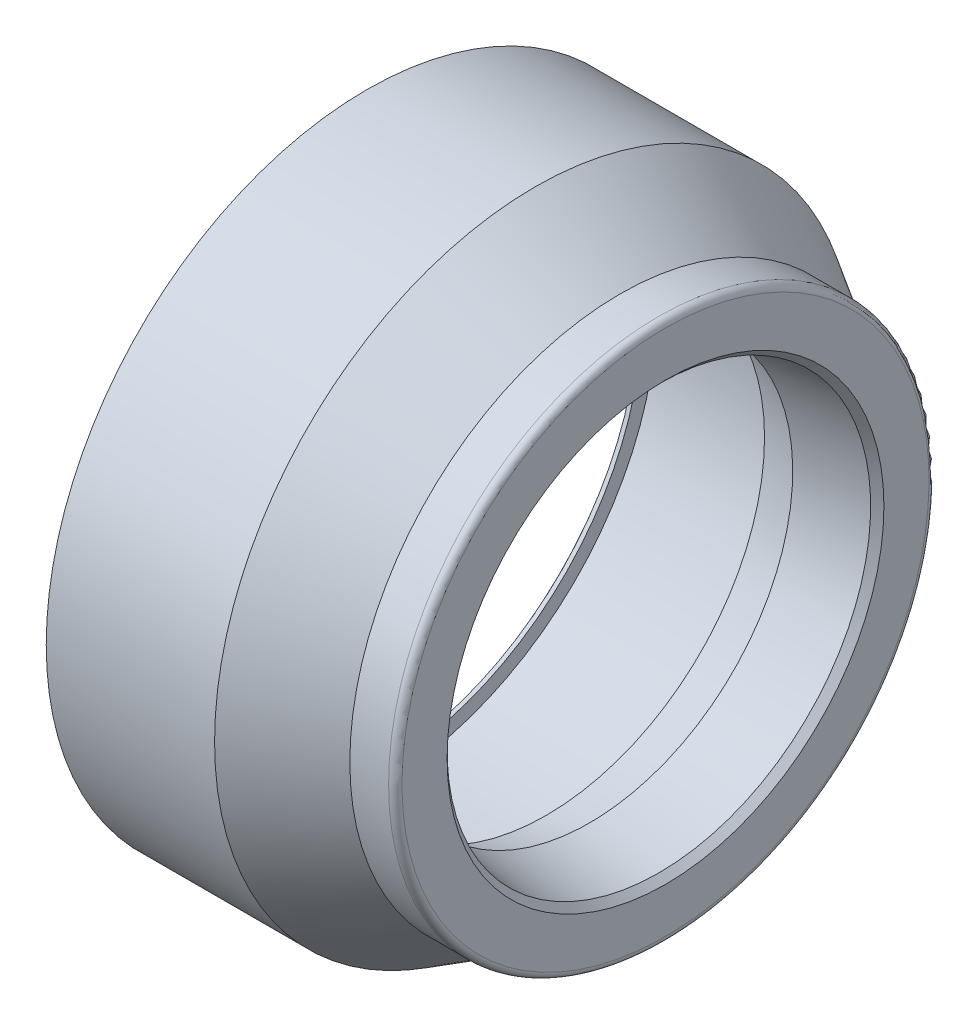
from build123d import *


with BuildPart() as part:
    # Sketch1 → Revolve1 (revolve)
    with BuildSketch(Plane.XY):
        with BuildLine():
            Line((0, 3.787125453), (-2.512581748, 1.274543705))
            Line((-2.512581748, 1.274543705), (-28.748040506, -1.99129637))
            Line((-28.748040506, -1.99129637), (-28.748040506, 1.274543705))
            Line((-28.748040506, 1.274543705), (-45.138961745, 3.724925992))
            Line((-45.138961745, 3.724925992), (-45.138961745, 23.778163338))
            ThreePointArc((-45.138961745, 23.778163338), (-45.88291052, 25.574214562), (-47.678961745, 26.318163338))
            Line((-47.678961745, 26.318163338), (-108.519758364, 26.318163338))
            Line((-108.519758364, 26.318163338), (-108.519758364, 20.827727871))
            Line((-108.519758364, 20.827727871), (-110.128287674, 20.827727871))
            Line((-110.128287674, 20.827727871), (-110.636200274, 24.90793993))
            Line((-110.636200274, 24.90793993), (-113.124151967, 25.000794493))
            Line((-113.124151967, 25.000794493), (-113.124151967, 42.441644403))
            Line((-113.124151967, 42.441644403), (-49.387204799, 42.441644403))
            Line((-49.387204799, 42.441644403), (-17.208900653, 23.413606967))
            Line((-17.208900653, 23.413606967), (-2.54, 23.413606967))
            ThreePointArc((-2.54, 23.413606967), (-0.743948776, 22.669658191), (0, 20.873606967))
            Line((0, 20.873606967), (0, 3.787125453))
        make_face()
    revolve(axis=Axis((-3.886465032, -78.906479914, 0), (-1, 0, 0)))


solid = part.part
